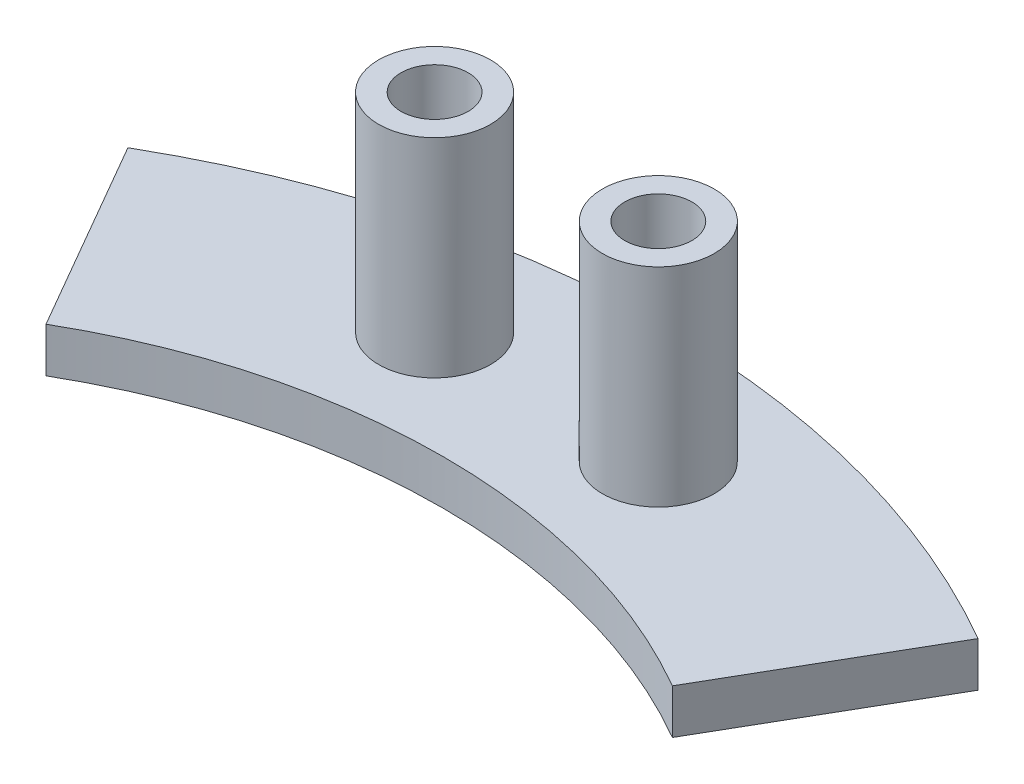
from build123d import *

# Parameters (mm, degrees)
BOSS_EXTRUDE1_DEPTH = 2
SKETCH2_R           = 2.5
BOSS_EXTRUDE2_DEPTH = 9.3
SKETCH5_R           = 1.5
CUT_EXTRUDE1_DEPTH  = 3.5
SKETCH6_R           = 1.5
CUT_EXTRUDE2_DEPTH  = 1


with BuildPart() as part:
    # Sketch1 → Boss-Extrude1 (new body)
    with BuildSketch(Plane(origin=(0, 0, 0), x_dir=(1, 0, 0), z_dir=(0, 1, 0))):
        with BuildLine():
            Line((-19, 32.908965344), (-14, 24.248711306))
            ThreePointArc((-14, 24.248711306), (0, 28), (14, 24.248711306))
            Line((14, 24.248711306), (19, 32.908965344))
            ThreePointArc((19, 32.908965344), (0, 38), (-19, 32.908965344))
        make_face()
    extrude(amount=BOSS_EXTRUDE1_DEPTH)

    # Sketch2 → Boss-Extrude2 (add)
    with BuildSketch(Plane(origin=(0, 2, 0), x_dir=(1, 0, 0), z_dir=(0, 1, 0))):
        with Locations((-5, 32.619012861)):
            Circle(SKETCH2_R)
        with Locations((5, 32.619012861)):
            Circle(SKETCH2_R)
    extrude(amount=BOSS_EXTRUDE2_DEPTH)

    # Sketch5 → Cut-Extrude1 (cut)
    with BuildSketch(Plane(origin=(0, 11.3, 0), x_dir=(1, 0, 0), z_dir=(0, 1, 0))):
        with Locations((-5, 32.619012861)):
            Circle(SKETCH5_R)
        with Locations((5, 32.619012861)):
            Circle(SKETCH5_R)
    extrude(amount=-CUT_EXTRUDE1_DEPTH, mode=Mode.SUBTRACT)

    # Sketch6 → Cut-Extrude2 (cut)
    with BuildSketch(Plane.XZ):
        with Locations((0, -33)):
            Circle(SKETCH6_R)
    extrude(amount=-CUT_EXTRUDE2_DEPTH, mode=Mode.SUBTRACT)


solid = part.part
